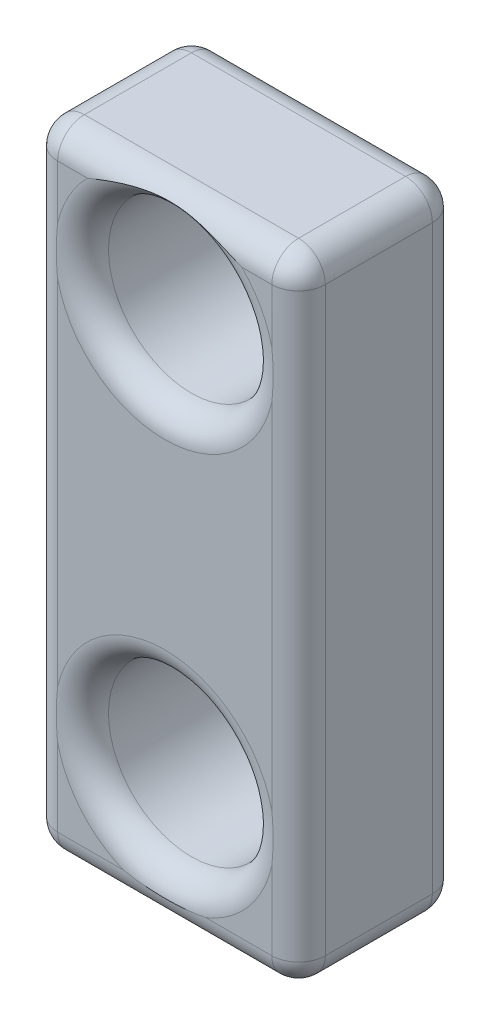
from build123d import *

# Parameters (mm, degrees)
SKETCH1_W           = 5
SKETCH1_H           = 11.858187168
SKETCH1_R           = 1.55
BOSS_EXTRUDE1_DEPTH = 3
FILLET1_R           = 0.5


with BuildPart() as part:
    # Sketch1 → Boss-Extrude1 (new body)
    with BuildSketch(Plane.XY):
        with Locations((0, -1.570906416)):
            Rectangle(SKETCH1_W, SKETCH1_H)
        with Locations((0, 2.400870974)):
            Circle(SKETCH1_R, mode=Mode.SUBTRACT)
        with Locations((0, -5.099129026)):
            Circle(SKETCH1_R, mode=Mode.SUBTRACT)
    extrude(amount=BOSS_EXTRUDE1_DEPTH)

    # Fillet1
    # the kernel refuses this fillet: 0.5 mm, written as the material it takes off along each edge
    with BuildSketch(Plane(origin=(2, -7, 2.5), x_dir=(1, 0, 0), z_dir=(0, -1, 0))) as fillet1_piece_1_section:
        Polygon((0, 0), (FILLET1_R, 0), (FILLET1_R, FILLET1_R), (0, FILLET1_R), align=None)
    fillet1_piece_1 = extrude(amount=FILLET1_R, mode=Mode.PRIVATE)
    fillet1_piece_1 = fillet1_piece_1 - Plane(origin=(2, -7, 2.5), x_dir=(-0.7071067811865475, 0, -0.7071067811865475), z_dir=(0, -1, 0)) * Sphere(FILLET1_R, mode=Mode.PRIVATE)
    add(fillet1_piece_1, mode=Mode.SUBTRACT)
    with BuildSketch(Plane(origin=(2, 3.858187168, 2.5), x_dir=(1, 0, 0), z_dir=(0, 1, 0))) as fillet1_piece_2_section:
        Polygon((0, 0), (FILLET1_R, 0), (FILLET1_R, -FILLET1_R), (0, -FILLET1_R), align=None)
    fillet1_piece_2 = extrude(amount=FILLET1_R, mode=Mode.PRIVATE)
    fillet1_piece_2 = fillet1_piece_2 - Plane(origin=(2, 3.858187168, 2.5), x_dir=(-0.7071067811865475, 0, -0.7071067811865475), z_dir=(0, 1, 0)) * Sphere(FILLET1_R, mode=Mode.PRIVATE)
    add(fillet1_piece_2, mode=Mode.SUBTRACT)
    with BuildSketch(Plane(origin=(-2, 3.858187168, 2.5), x_dir=(-1, 0, 0), z_dir=(0, 1, 0))) as fillet1_piece_3_section:
        Polygon((0, 0), (FILLET1_R, 0), (FILLET1_R, FILLET1_R), (0, FILLET1_R), align=None)
    fillet1_piece_3 = extrude(amount=FILLET1_R, mode=Mode.PRIVATE)
    fillet1_piece_3 = fillet1_piece_3 - Plane(origin=(-2, 3.858187168, 2.5), x_dir=(0.7071067811865475, 0, -0.7071067811865475), z_dir=(0, 1, 0)) * Sphere(FILLET1_R, mode=Mode.PRIVATE)
    add(fillet1_piece_3, mode=Mode.SUBTRACT)
    with BuildSketch(Plane(origin=(-2, -7, 2.5), x_dir=(0, -1, 0), z_dir=(-1, 0, 0))) as fillet1_piece_4_section:
        Polygon((0, 0), (FILLET1_R, 0), (FILLET1_R, FILLET1_R), (0, FILLET1_R), align=None)
    fillet1_piece_4 = extrude(amount=FILLET1_R, mode=Mode.PRIVATE)
    fillet1_piece_4 = fillet1_piece_4 - Plane(origin=(-2, -7, 2.5), x_dir=(0, 0.7071067811865475, -0.7071067811865475), z_dir=(-1, 0, 0)) * Sphere(FILLET1_R, mode=Mode.PRIVATE)
    add(fillet1_piece_4, mode=Mode.SUBTRACT)
    with BuildSketch(Plane(origin=(2, 3.858187168, 0.5), x_dir=(1, 0, 0), z_dir=(0, 1, 0))) as fillet1_piece_5_section:
        Polygon((0, 0), (FILLET1_R, 0), (FILLET1_R, FILLET1_R), (0, FILLET1_R), align=None)
    fillet1_piece_5 = extrude(amount=FILLET1_R, mode=Mode.PRIVATE)
    fillet1_piece_5 = fillet1_piece_5 - Plane(origin=(2, 3.858187168, 0.5), x_dir=(-0.7071067811865475, 0, 0.7071067811865475), z_dir=(0, 1, 0)) * Sphere(FILLET1_R, mode=Mode.PRIVATE)
    add(fillet1_piece_5, mode=Mode.SUBTRACT)
    with BuildSketch(Plane(origin=(-2, 3.858187168, 0.5), x_dir=(-1, 0, 0), z_dir=(0, 1, 0))) as fillet1_piece_6_section:
        Polygon((0, 0), (FILLET1_R, 0), (FILLET1_R, -FILLET1_R), (0, -FILLET1_R), align=None)
    fillet1_piece_6 = extrude(amount=FILLET1_R, mode=Mode.PRIVATE)
    fillet1_piece_6 = fillet1_piece_6 - Plane(origin=(-2, 3.858187168, 0.5), x_dir=(0.7071067811865475, 0, 0.7071067811865475), z_dir=(0, 1, 0)) * Sphere(FILLET1_R, mode=Mode.PRIVATE)
    add(fillet1_piece_6, mode=Mode.SUBTRACT)
    with BuildSketch(Plane(origin=(2, -7, 0.5), x_dir=(1, 0, 0), z_dir=(0, -1, 0))) as fillet1_piece_7_section:
        Polygon((0, 0), (FILLET1_R, 0), (FILLET1_R, -FILLET1_R), (0, -FILLET1_R), align=None)
    fillet1_piece_7 = extrude(amount=FILLET1_R, mode=Mode.PRIVATE)
    fillet1_piece_7 = fillet1_piece_7 - Plane(origin=(2, -7, 0.5), x_dir=(-0.7071067811865475, 0, 0.7071067811865475), z_dir=(0, -1, 0)) * Sphere(FILLET1_R, mode=Mode.PRIVATE)
    add(fillet1_piece_7, mode=Mode.SUBTRACT)
    with BuildSketch(Plane(origin=(-2, -7, 0.5), x_dir=(0, -1, 0), z_dir=(-1, 0, 0))) as fillet1_piece_8_section:
        Polygon((0, 0), (FILLET1_R, 0), (FILLET1_R, -FILLET1_R), (0, -FILLET1_R), align=None)
    fillet1_piece_8 = extrude(amount=FILLET1_R, mode=Mode.PRIVATE)
    fillet1_piece_8 = fillet1_piece_8 - Plane(origin=(-2, -7, 0.5), x_dir=(0, 0.7071067811865475, 0.7071067811865475), z_dir=(-1, 0, 0)) * Sphere(FILLET1_R, mode=Mode.PRIVATE)
    add(fillet1_piece_8, mode=Mode.SUBTRACT)
    with BuildSketch(Plane(origin=(0, 2.400870974, 0), x_dir=(1, 0, 0), z_dir=(0, -1, 0))) as fillet1_piece_9:
        with BuildLine():
            CenterArc((1.55 + FILLET1_R, FILLET1_R), FILLET1_R, 180, 90)
            Line((1.55 + FILLET1_R, 0), (1.55, 0))
            Line((1.55, 0), (1.55, FILLET1_R))
        make_face()
    revolve(axis=Axis((0, 2.400870974, 0), (0, 0, 1)), mode=Mode.SUBTRACT)
    with BuildSketch(Plane(origin=(0, 2.400870974, 3), x_dir=(1, 0, 0), z_dir=(0, -1, 0))) as fillet1_piece_10:
        with BuildLine():
            CenterArc((1.55 + FILLET1_R, -FILLET1_R), FILLET1_R, 90, 90)
            Line((1.55 + FILLET1_R, 0), (1.55, 0))
            Line((1.55, 0), (1.55, -FILLET1_R))
        make_face()
    revolve(axis=Axis((0, 2.400870974, 3), (0, 0, 1)), mode=Mode.SUBTRACT)
    with BuildSketch(Plane(origin=(2.5, -7, 3), x_dir=(0, 0, -1), z_dir=(0, 1, 0)), Plane(origin=(-2.5, 3.858187168, 3), x_dir=(0, 0, -1), z_dir=(0, -1, 0))) as fillet1_piece_11:
        with BuildLine():
            CenterArc((FILLET1_R, FILLET1_R), FILLET1_R, 180, 90)
            Line((0, FILLET1_R), (0, 0))
            Line((0, 0), (FILLET1_R, 0))
        make_face()
    extrude(amount=10.858187168, mode=Mode.SUBTRACT)
    with BuildSketch(Plane(origin=(0, -5.099129026, 0), x_dir=(1, 0, 0), z_dir=(0, -1, 0))) as fillet1_piece_12:
        with BuildLine():
            CenterArc((1.55 + FILLET1_R, FILLET1_R), FILLET1_R, 180, 90)
            Line((1.55 + FILLET1_R, 0), (1.55, 0))
            Line((1.55, 0), (1.55, FILLET1_R))
        make_face()
    revolve(axis=Axis((0, -5.099129026, 0), (0, 0, 1)), mode=Mode.SUBTRACT)
    with BuildSketch(Plane(origin=(0, -5.099129026, 3), x_dir=(1, 0, 0), z_dir=(0, -1, 0))) as fillet1_piece_13:
        with BuildLine():
            CenterArc((1.55 + FILLET1_R, -FILLET1_R), FILLET1_R, 90, 90)
            Line((1.55 + FILLET1_R, 0), (1.55, 0))
            Line((1.55, 0), (1.55, -FILLET1_R))
        make_face()
    revolve(axis=Axis((0, -5.099129026, 3), (0, 0, 1)), mode=Mode.SUBTRACT)
    with BuildSketch(Plane(origin=(2, 4.358187168, 3), x_dir=(0, 0, -1), z_dir=(-1, 0, 0)), Plane(origin=(-2, -7.5, 3), x_dir=(0, 0, -1), z_dir=(1, 0, 0))) as fillet1_piece_14:
        with BuildLine():
            CenterArc((FILLET1_R, FILLET1_R), FILLET1_R, 180, 90)
            Line((0, FILLET1_R), (0, 0))
            Line((0, 0), (FILLET1_R, 0))
        make_face()
    extrude(amount=4, mode=Mode.SUBTRACT)
    with BuildSketch(Plane(origin=(2, 4.358187168, 0), x_dir=(0, 0, 1), z_dir=(-1, 0, 0)), Plane(origin=(-2, -7.5, 0), x_dir=(0, 0, 1), z_dir=(1, 0, 0))) as fillet1_piece_15:
        with BuildLine():
            CenterArc((FILLET1_R, -FILLET1_R), FILLET1_R, 90, 90)
            Line((0, -FILLET1_R), (0, 0))
            Line((0, 0), (FILLET1_R, 0))
        make_face()
    extrude(amount=4, mode=Mode.SUBTRACT)
    with BuildSketch(Plane(origin=(2.5, -7, 0), x_dir=(0, 0, 1), z_dir=(0, 1, 0)), Plane(origin=(-2.5, 3.858187168, 0), x_dir=(0, 0, 1), z_dir=(0, -1, 0))) as fillet1_piece_16:
        with BuildLine():
            CenterArc((FILLET1_R, -FILLET1_R), FILLET1_R, 90, 90)
            Line((0, -FILLET1_R), (0, 0))
            Line((0, 0), (FILLET1_R, 0))
        make_face()
    extrude(amount=10.858187168, mode=Mode.SUBTRACT)
    with BuildSketch(Plane(origin=(-2.5, 4.358187168, 0.5), x_dir=(1, 0, 0), z_dir=(0, 0, 1)), Plane(origin=(2.5, -7.5, 0.5), x_dir=(-1, 0, 0), z_dir=(0, 0, 1)), Plane(origin=(-2.5, -7.5, 0.5), x_dir=(0, 1, 0), z_dir=(0, 0, 1))) as fillet1_piece_17:
        with BuildLine():
            CenterArc((FILLET1_R, -FILLET1_R), FILLET1_R, 90, 90)
            Line((0, -FILLET1_R), (0, 0))
            Line((0, 0), (FILLET1_R, 0))
        make_face()
    extrude(amount=2, mode=Mode.SUBTRACT)
    with BuildSketch(Plane(origin=(2.5, 4.358187168, 0.5), x_dir=(-1, 0, 0), z_dir=(0, 0, 1))) as fillet1_piece_18:
        with BuildLine():
            CenterArc((FILLET1_R, FILLET1_R), FILLET1_R, 180, 90)
            Line((0, FILLET1_R), (0, 0))
            Line((0, 0), (FILLET1_R, 0))
        make_face()
    extrude(amount=2, mode=Mode.SUBTRACT)


solid = part.part
